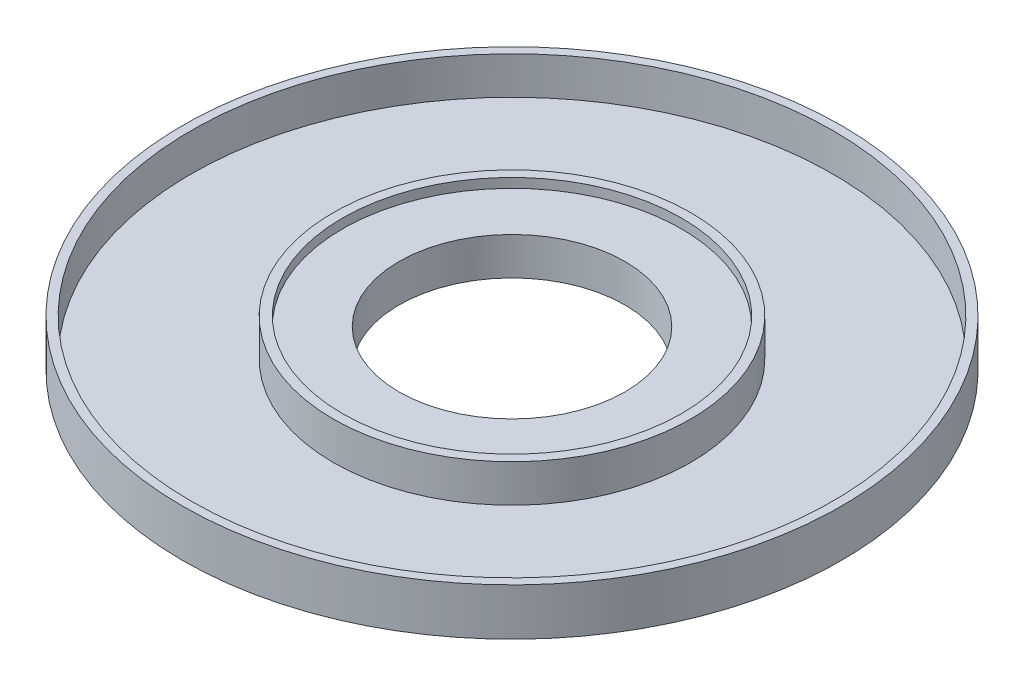
from build123d import *

# Parameters (mm, degrees)
SKETCH1_R               = 1750
BOSS_EXTRUDE1_DEPTH     = 500
SKETCH2_R               = 900
CUT_EXTRUDE2_DEPTH      = 300
SKETCH3_R               = 600
CUT_EXTRUDE3_DEPTH      = 300
SKETCH4_R               = 1704.219614443
SKETCH4_R_2             = 949.302115811
CUT_EXTRUDE4_DEPTH      = 450
CUT_EXTRUDE5_DEPTH      = 2525.876234591
CUT_EXTRUDE5_DEPTH_BACK = 2525.876234591


with BuildPart() as part:
    # Sketch1 → Boss-Extrude1 (new body)
    with BuildSketch(Plane(origin=(0, 0, 0), x_dir=(1, 0, 0), z_dir=(0, 1, 0))):
        Circle(SKETCH1_R)
    extrude(amount=BOSS_EXTRUDE1_DEPTH)

    # Sketch2 → Cut-Extrude2 (cut)
    with BuildSketch(Plane(origin=(0, 500, 0), x_dir=(1, 0, 0), z_dir=(0, 1, 0))):
        Circle(SKETCH2_R)
    extrude(amount=-CUT_EXTRUDE2_DEPTH, mode=Mode.SUBTRACT)

    # Sketch3 → Cut-Extrude3 (cut)
    with BuildSketch(Plane.XZ):
        Circle(SKETCH3_R)
    extrude(amount=-CUT_EXTRUDE3_DEPTH, mode=Mode.SUBTRACT)

    # Sketch4 → Cut-Extrude4 (cut)
    with BuildSketch(Plane(origin=(0, 500, 0), x_dir=(1, 0, 0), z_dir=(0, 1, 0))):
        Circle(SKETCH4_R)
        Circle(SKETCH4_R_2, mode=Mode.SUBTRACT)
    extrude(amount=-CUT_EXTRUDE4_DEPTH, mode=Mode.SUBTRACT)

    # Sketch6 → Cut-Extrude5 (cut, two sides: drawn at the far end of the back side and taken through both)
    with BuildSketch(Plane(origin=(0, 0, 0), x_dir=(0, 0, -1), z_dir=(1, 0, 0)).offset(-CUT_EXTRUDE5_DEPTH_BACK)):
        Polygon((-1750, 250), (0, 250), (1750, 250), (1750, 500), (-1750, 500), align=None)
    extrude(amount=CUT_EXTRUDE5_DEPTH + CUT_EXTRUDE5_DEPTH_BACK, mode=Mode.SUBTRACT)


solid = part.part
